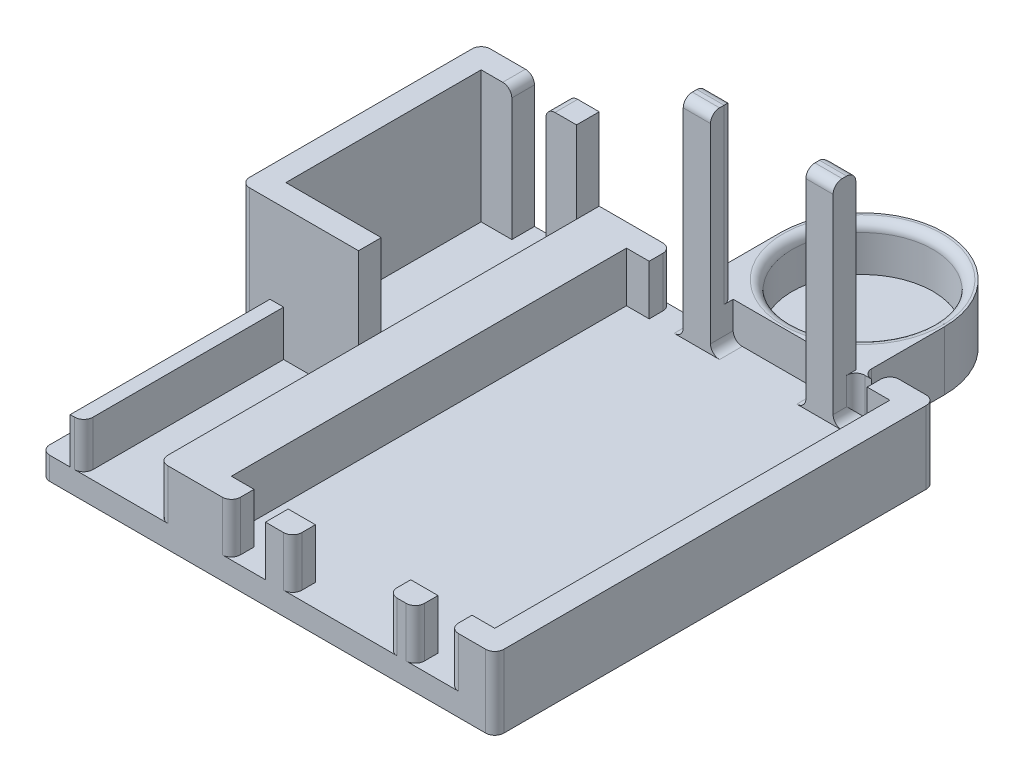
from build123d import *

# Parameters (mm, degrees)
BOSS_EXTRUDE1_DEPTH      = 92
SKETCH2_4_W              = 5
SKETCH2_4_H              = 29
SKETCH2_4_W_2            = 58
SKETCH2_4_H_2            = 11
BOSS_EXTRUDE2_DEPTH      = 5
SKETCH2_6_W              = 5
SKETCH2_6_H              = 29
BOSS_EXTRUDE3_DEPTH      = 53
BOSS_EXTRUDE4_DEPTH      = 5
SKETCH6_W                = 3.75
SKETCH6_H                = 5
CUT_EXTRUDE1_DEPTH       = 29
BOSS_EXTRUDE5_DEPTH      = 3
BOSS_EXTRUDE6_DEPTH      = 13
SKETCH9_W                = 58
SKETCH9_H                = 11
BOSS_EXTRUDE7_DEPTH      = 5
SKETCH13_W               = 3
SKETCH13_H               = 44
BOSS_EXTRUDE9_DEPTH      = 10
FILLET1_R                = 2
CUT_EXTRUDE2_START       = -97
CUT_EXTRUDE2_OUTLINE_W   = 7.5
CUT_EXTRUDE2_OUTLINE_H   = 11
CUT_EXTRUDE2_OUTLINE_W_2 = 21
CUT_EXTRUDE2_DEPTH       = 97
SKETCH11_W               = 6
SKETCH11_H               = 5
BOSS_EXTRUDE8_DEPTH      = 35
FILLET2_R                = 2


# Read off the part's stored shape, not the designer's step: Cut-Extrude2
with BuildPart() as part:
    # Sketch2 → Boss-Extrude1 (new body)
    with BuildSketch(Plane.XY):
        Polygon((0, 16), (-5, 16), (-5, 5), (-63, 5), (-63, 16), (-74, 16), (-74, 5), (-100, 5), (-100, 0), (0, 0), align=None)
    extrude(amount=BOSS_EXTRUDE1_DEPTH)

    # Sketch2<4> → Boss-Extrude2 (add)
    with BuildSketch(Plane.XY):
        Polygon((-74, 0), (-74, 5), (-95, 5), (-100, 5), (-100, 0), align=None)
        with Locations((-97.5, 19.5)):
            Rectangle(SKETCH2_4_W, SKETCH2_4_H)
        Polygon((-74, 5), (-74, 16), (-74, 34), (-95, 34), (-95, 5), align=None)
        with Locations((-34, 10.5)):
            Rectangle(SKETCH2_4_W_2, SKETCH2_4_H_2)
    extrude(amount=BOSS_EXTRUDE2_DEPTH)

    # Sketch2<6> → Boss-Extrude3 (add)
    with BuildSketch(Plane.XY):
        Polygon((-74, 0), (-74, 5), (-95, 5), (-100, 5), (-100, 0), align=None)
        with Locations((-97.5, 19.5)):
            Rectangle(SKETCH2_6_W, SKETCH2_6_H)
    extrude(amount=BOSS_EXTRUDE3_DEPTH)

    # Sketch3 → Boss-Extrude4 (add)
    with BuildSketch(Plane.XY.offset(53)):
        Polygon((-95, 34), (-95, 5), (-74, 5), (-74, 16), (-74, 34), align=None)
    extrude(amount=-BOSS_EXTRUDE4_DEPTH)

    # Sketch6 → Cut-Extrude1 (cut)
    with BuildSketch(Plane(origin=(0, 34, 0), x_dir=(1, 0, 0), z_dir=(0, 1, 0))):
        with Locations((-82.625, -2.5)):
            Rectangle(SKETCH6_W, SKETCH6_H)
        with Locations((-86.375, -2.5)):
            Rectangle(SKETCH6_W, SKETCH6_H)
    extrude(amount=-CUT_EXTRUDE1_DEPTH, mode=Mode.SUBTRACT)

    # Sketch7 → Boss-Extrude5 (add)
    with BuildSketch(Plane(origin=(0, 0, 0), x_dir=(1, 0, 0), z_dir=(0, 1, 0))):
        with BuildLine():
            ThreePointArc((-16, 18), (-21.272077939, 5.272077939), (-34, 0))
            Line((-34, 0), (-16, 0))
            Line((-16, 0), (-16, 18))
        make_face()
        with BuildLine():
            Line((-52, 0), (-34, 0))
            ThreePointArc((-34, 0), (-46.727922061, 5.272077939), (-52, 18))
            Line((-52, 18), (-52, 0))
        make_face()
        with BuildLine():
            ThreePointArc((-52, 18), (-46.727922061, 5.272077939), (-34, 0))
            Line((-34, 0), (-34, 2.5))
            ThreePointArc((-34, 2.5), (-49.5, 18), (-34, 33.5))
            Line((-34, 33.5), (-34, 36))
            ThreePointArc((-34, 36), (-46.727922061, 30.727922061), (-52, 18))
        make_face()
        with BuildLine():
            Line((-34, 2.5), (-34, 0))
            ThreePointArc((-34, 0), (-21.272077939, 5.272077939), (-16, 18))
            ThreePointArc((-16, 18), (-21.272077939, 30.727922061), (-34, 36))
            Line((-34, 36), (-34, 33.5))
            ThreePointArc((-34, 33.5), (-23.039844892, 28.960155108), (-18.5, 18))
            ThreePointArc((-18.5, 18), (-23.039844892, 7.039844892), (-34, 2.5))
        make_face()
        with BuildLine():
            ThreePointArc((-34, 33.5), (-49.5, 18), (-34, 2.5))
            Line((-34, 2.5), (-34, 33.5))
        make_face()
        with BuildLine():
            Line((-34, 33.5), (-34, 2.5))
            ThreePointArc((-34, 2.5), (-23.039844892, 7.039844892), (-18.5, 18))
            ThreePointArc((-18.5, 18), (-23.039844892, 28.960155108), (-34, 33.5))
        make_face()
    extrude(amount=BOSS_EXTRUDE5_DEPTH)

    # Sketch7<3> → Boss-Extrude6 (add)
    with BuildSketch(Plane(origin=(0, 0, 0), x_dir=(1, 0, 0), z_dir=(0, 1, 0))):
        with BuildLine():
            Line((-52, 0), (-34, 0))
            ThreePointArc((-34, 0), (-46.727922061, 5.272077939), (-52, 18))
            Line((-52, 18), (-52, 0))
        make_face()
        with BuildLine():
            ThreePointArc((-52, 18), (-46.727922061, 5.272077939), (-34, 0))
            Line((-34, 0), (-34, 2.5))
            ThreePointArc((-34, 2.5), (-49.5, 18), (-34, 33.5))
            Line((-34, 33.5), (-34, 36))
            ThreePointArc((-34, 36), (-46.727922061, 30.727922061), (-52, 18))
        make_face()
        with BuildLine():
            Line((-34, 2.5), (-34, 0))
            ThreePointArc((-34, 0), (-21.272077939, 5.272077939), (-16, 18))
            ThreePointArc((-16, 18), (-21.272077939, 30.727922061), (-34, 36))
            Line((-34, 36), (-34, 33.5))
            ThreePointArc((-34, 33.5), (-23.039844892, 28.960155108), (-18.5, 18))
            ThreePointArc((-18.5, 18), (-23.039844892, 7.039844892), (-34, 2.5))
        make_face()
        with BuildLine():
            ThreePointArc((-16, 18), (-21.272077939, 5.272077939), (-34, 0))
            Line((-34, 0), (-16, 0))
            Line((-16, 0), (-16, 18))
        make_face()
    extrude(amount=BOSS_EXTRUDE6_DEPTH)

    # Sketch9 → Boss-Extrude7 (add)
    with BuildSketch(Plane.XY.offset(92)):
        with Locations((-34, 10.5)):
            Rectangle(SKETCH9_W, SKETCH9_H)
        Polygon((-63, 16), (-74, 16), (-74, 5), (-100, 5), (-100, 0), (0, 0), (0, 16), (-5, 16), (-5, 5), (-63, 5), align=None)
    extrude(amount=BOSS_EXTRUDE7_DEPTH)

    # Sketch13 → Boss-Extrude9 (add)
    with BuildSketch(Plane(origin=(0, 5, 0), x_dir=(1, 0, 0), z_dir=(0, 1, 0))):
        with Locations((-92, -75)):
            Rectangle(SKETCH13_W, SKETCH13_H)
    extrude(amount=BOSS_EXTRUDE9_DEPTH)

    # Fillet1
    fillet1_edges = [part.edges().sort_by_distance(p)[0] for p in [
        (-100, 19.5, 53),
        (0, 8, 0),
        (-80.75, 34, 2.5),
        (-88.25, 34, 2.5),
        (-16, 6.5, 0),
        (-52, 6.5, 0),
        (-34, 13, -2.5),
        (-74, 10.5, 97),
        (-100, 2.5, 97),
        (0, 8, 97),
        (-100, 17, 0),
    ]]
    fillet(fillet1_edges, radius=FILLET1_R)

    # Cut-Extrude2 outline → Cut-Extrude2 (cut)
    with BuildSketch(Plane.XY.offset(97).offset(CUT_EXTRUDE2_START)):
        with Locations((-13.75, 10.5)):
            Rectangle(CUT_EXTRUDE2_OUTLINE_W, CUT_EXTRUDE2_OUTLINE_H)
        with Locations((-34, 10.5)):
            Rectangle(CUT_EXTRUDE2_OUTLINE_W_2, CUT_EXTRUDE2_OUTLINE_H)
        with Locations((-54.25, 10.5)):
            Rectangle(CUT_EXTRUDE2_OUTLINE_W, CUT_EXTRUDE2_OUTLINE_H)
    extrude(amount=CUT_EXTRUDE2_DEPTH, mode=Mode.SUBTRACT)

    # Sketch11 → Boss-Extrude8 (add)
    with BuildSketch(Plane(origin=(0, 16, 0), x_dir=(1, 0, 0), z_dir=(0, 1, 0))):
        with Locations((-20.5, -2.5)):
            Rectangle(SKETCH11_W, SKETCH11_H)
        with Locations((-47.5, -2.5)):
            Rectangle(SKETCH11_W, SKETCH11_H)
    extrude(amount=BOSS_EXTRUDE8_DEPTH)

    # Fillet2
    fillet2_edges = [part.edges().sort_by_distance(p)[0] for p in [
        (-90.5, 10, 97),
        (-10, 10.5, 97),
        (-17.5, 10.5, 97),
        (-10, 10.5, 0),
        (-17.5, 5, 2.5),
        (-17.5, 9, 0),
        (-58, 10.5, 0),
        (-58, 10.5, 97),
        (-50.5, 9, 0),
        (-50.5, 5, 2.5),
        (-44.5, 32, 0),
        (-23.5, 10.5, 97),
        (-23.5, 5, 2.5),
        (-44.5, 5, 2.5),
        (-44.5, 10.5, 97),
        (-23.5, 32, 0),
        (-20.5, 51, 0),
        (-20.5, 51, 5),
        (-47.5, 51, 0),
        (-47.5, 51, 5),
    ]]
    fillet(fillet2_edges, radius=FILLET2_R)


solid = part.part
